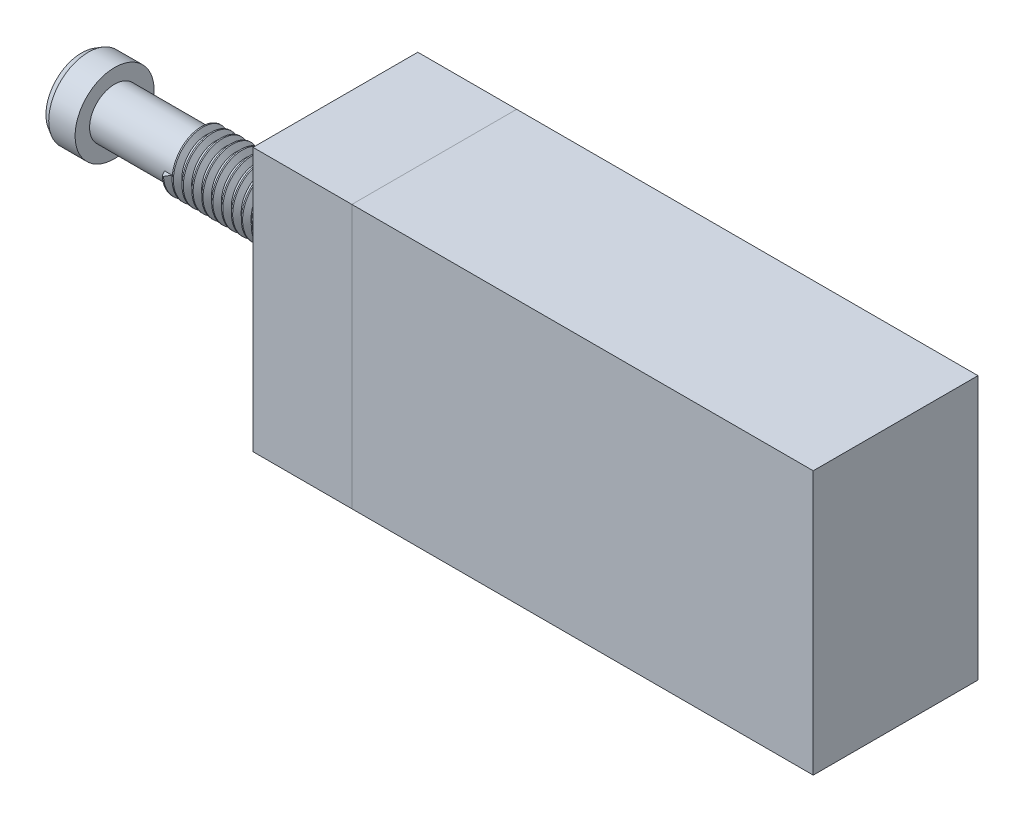
from build123d import *

# Parameters (mm, degrees)
EXTRUDE_1_DEPTH      = 25
SKETCH_2_W           = 3
SKETCH_2_H           = 40
EXTRUDE_2_DEPTH      = 70
SKETCH_4_W           = 5
SKETCH_4_H           = 30
EXTRUDE_3_DEPTH      = 22
SKETCH_11_W          = 3
SKETCH_11_H          = 29.924086267
CUT_EXTRUDE_3_DEPTH  = 7
SKETCH_13_W          = 3
SKETCH_13_H          = 30
EXTRUDE_5_DEPTH      = 25
SKETCH_6_W           = 3
SKETCH_6_H           = 5
SKETCH_6_H_2         = 30
SKETCH_6_W_2         = 19
SKETCH_6_W_3         = 22
SKETCH_6_H_3         = 40
EXTRUDE_6_DEPTH      = 15
SKETCH_14_W          = 19
SKETCH_14_H          = 34
SKETCH_14_R          = 4
CUT_EXTRUDE_4_DEPTH  = 7
SKETCH_14_2_R        = 4
CUT_EXTRUDE_5_DEPTH  = 9
SKETCH_8_R           = 4
CUT_EXTRUDE_6_DEPTH  = 10
THREAD_1_PITCH       = 1.5
SKETCH_14_3_R        = 4
EXTRUDE_7_DEPTH      = 55
SKETCH_20_R          = 6
EXTRUDE_8_DEPTH      = 5
CUT_EXTRUDE_START    = -5
SKETCH_20_10_R       = 4
SKETCH_20_10_R_2     = 3.8
CUT_EXTRUDE_10_DEPTH = 50
CHAMFER_3_SIZE       = 1
CHAMFER_3_SIZE2      = 0.577350269
CHAMFER_4_SIZE       = 1
CHAMFER_4_SIZE2      = 0.577350269
THREAD_2_PITCH       = 1.5


with BuildPart() as part:
    # Sketch 1 → 보스-돌출1 (new body)
    with BuildSketch(Plane.XY):
        Polygon((-70, 5), (-70, 0), (0, 0), (0, 40), (-70, 40), (-70, 35), (-5, 35), (-5, 5), align=None)
    extrude(amount=EXTRUDE_1_DEPTH)

    # 스케치2 → 보스-돌출2 (add)
    with BuildSketch(Plane(origin=(0, 0, 0), x_dir=(0, 0, -1), z_dir=(1, 0, 0))):
        with Locations((-23.5, 20)):
            Rectangle(SKETCH_2_W, SKETCH_2_H)
    extrude(amount=-EXTRUDE_2_DEPTH)

    # Sketch 4 → 보스-돌출3 (add)
    with BuildSketch(Plane(origin=(0, 0, 22), x_dir=(-1, 0, 0), z_dir=(0, 0, -1))):
        with Locations((57.5, 20)):
            Rectangle(SKETCH_4_W, SKETCH_4_H)
    extrude(amount=EXTRUDE_3_DEPTH)

    # 스케치11 → 컷-돌출3 (cut)
    with BuildSketch(Plane.ZY.offset(60)):
        with Locations((1.5, 20.037956867)):
            Rectangle(SKETCH_11_W, SKETCH_11_H)
    extrude(amount=-CUT_EXTRUDE_3_DEPTH, mode=Mode.SUBTRACT)

    # 스케치8 → 컷-돌출6 (cut)
    with BuildSketch(Plane.ZY.offset(60)):
        with Locations(Location((11, 20, 0), (0, 0, 180))):
            Circle(SKETCH_8_R)
    extrude(amount=-CUT_EXTRUDE_6_DEPTH, mode=Mode.SUBTRACT)

    # 나사산1: the profile of Sketch 1 2 profile screwed along a right-hand helix of 10 turns, 8 arcs to a turn; built about Z, then put on its axis
    thread_1_z = Axis((0, 0, 0), (0, 0, 1))
    thread_1_corners = [(3.9997, 0, -0.000173205), (4.811898812, 0, 0.468749998), (4.811898812, 0, 0.656249998), (3.9997, 0, 1.125173201)]
    with BuildLine(mode=Mode.PRIVATE) as thread_1_profile:
        Line(thread_1_corners[0], thread_1_corners[1])
        Line(thread_1_corners[1], thread_1_corners[2])
        Line(thread_1_corners[2], thread_1_corners[3])
        Line(thread_1_corners[3], thread_1_corners[0])
    thread_1_cap = Face(thread_1_profile.wire())
    thread_1_turn_angles = [0, 22.5, 45, 67.5, 90, 112.5, 135, 157.5, 180, 202.5, 225, 247.5, 270, 292.5, 315, 337.5, 360]
    thread_1_turn_weights = [1, 0.9238795325112867, 1, 0.9238795325112867, 1, 0.9238795325112867, 1, 0.9238795325112867, 1, 0.9238795325112867, 1, 0.9238795325112867, 1, 0.9238795325112867, 1, 0.9238795325112867, 1]
    thread_1_turn_rails = [Edge.make_bspline([Vector(p[0], p[1], 0).rotate(thread_1_z, thread_1_turn_angles[k]) / thread_1_turn_weights[k] + Vector(0, 0, p[2] + THREAD_1_PITCH * thread_1_turn_angles[k] / 360) for k in range(17)], [0, 0, 0, 1, 1, 2, 2, 3, 3, 4, 4, 5, 5, 6, 6, 7, 7, 8, 8, 8], 2, thread_1_turn_weights) for p in thread_1_corners]
    thread_1_turn_sides = [Face.make_surface_from_curves(thread_1_turn_rails[p[0]], thread_1_turn_rails[p[1]]) for p in [(0, 1), (1, 2), (2, 3), (3, 0)]]
    thread_1 = Plane(origin=(-70, 20, 11), x_dir=(0, 0, -1), z_dir=(1, 0, 0)) * Solid(Shell([*[p.moved(Location((0, 0, THREAD_1_PITCH * i))) for i in range(10) for p in thread_1_turn_sides], thread_1_cap, thread_1_cap.rotate(thread_1_z, 3600).moved(Location((0, 0, THREAD_1_PITCH * 3600 / 360)))]))
    add(thread_1, mode=Mode.SUBTRACT)


with BuildPart() as body_2:
    # 스케치13 → 보스-돌출5 (new body)
    with BuildSketch(Plane.ZY.offset(70)):
        with Locations((1.5, 20.075913733)):
            Rectangle(SKETCH_13_W, SKETCH_13_H)
    extrude(amount=-EXTRUDE_5_DEPTH)

    # 스케치6 → 보스-돌출6 (add)
    with BuildSketch(Plane.ZY.offset(70)):
        with Locations((1.5, 2.5)):
            Rectangle(SKETCH_6_W, SKETCH_6_H)
        with Locations((1.5, 20)):
            Rectangle(SKETCH_6_W, SKETCH_6_H_2)
        with Locations((1.5, 37.5)):
            Rectangle(SKETCH_6_W, SKETCH_6_H)
        with Locations((12.5, 20)):
            Rectangle(SKETCH_6_W_2, SKETCH_6_H_2)
        Polygon((25, 40), (3, 40), (3, 35), (22, 35), (22, 5), (3, 5), (3, 0), (25, 0), align=None)
        with Locations((14, 20)):
            Rectangle(SKETCH_6_W_3, SKETCH_6_H_3)
    extrude(amount=EXTRUDE_6_DEPTH)

    # 스케치14 → 컷-돌출4 (cut)
    with BuildSketch(Plane(origin=(-70, 0, 0), x_dir=(0, 0, -1), z_dir=(1, 0, 0))):
        with Locations((-12.5, 20)):
            Rectangle(SKETCH_14_W, SKETCH_14_H)
        with Locations((-11, 20)):
            Circle(SKETCH_14_R, mode=Mode.SUBTRACT)
    extrude(amount=-CUT_EXTRUDE_4_DEPTH, mode=Mode.SUBTRACT)

    # 스케치14<2> → 컷-돌출5 (cut)
    with BuildSketch(Plane(origin=(-70, 0, 0), x_dir=(0, 0, -1), z_dir=(1, 0, 0))):
        with Locations((-11, 20)):
            Circle(SKETCH_14_2_R)
    extrude(amount=-CUT_EXTRUDE_5_DEPTH, mode=Mode.SUBTRACT)


with BuildPart() as body_3:
    # 스케치14<3> → 보스-돌출7 (new body)
    with BuildSketch(Plane(origin=(-70, 0, 0), x_dir=(0, 0, -1), z_dir=(1, 0, 0))):
        with Locations((-11, 20)):
            Circle(SKETCH_14_3_R)
    extrude(amount=-EXTRUDE_7_DEPTH)

    # 스케치20 → 보스-돌출8 (add)
    with BuildSketch(Plane.ZY.offset(125)):
        with Locations((11, 20)):
            Circle(SKETCH_20_R)
    extrude(amount=-EXTRUDE_8_DEPTH)

    # 스케치20<10> → 컷-돌출10 (cut)
    with BuildSketch(Plane.ZY.offset(125).offset(CUT_EXTRUDE_START)):
        with Locations(Location((11, 20, 0), (0, 0, 180))):
            Circle(SKETCH_20_10_R)
        with Locations((11, 20)):
            Circle(SKETCH_20_10_R_2, mode=Mode.SUBTRACT)
    extrude(amount=-CUT_EXTRUDE_10_DEPTH, mode=Mode.SUBTRACT)

    # 모따기3
    chamfer_3_edges = [body_3.edges().sort_by_distance(p)[0] for p in [
        (-70, 20, 7.2),
    ]]
    chamfer_3_side = [body_3.faces().sort_by_distance(p)[0] for p in [
        (-70, 20, 11),
    ]]
    chamfer(chamfer_3_edges, length=CHAMFER_3_SIZE, length2=CHAMFER_3_SIZE2, reference=chamfer_3_side[0])

    # 모따기4
    chamfer_4_edges = [body_3.edges().sort_by_distance(p)[0] for p in [
        (-125, 20, 5),
    ]]
    chamfer_4_side = [body_3.faces().sort_by_distance(p)[0] for p in [
        (-122.5, 20, 5),
    ]]
    chamfer(chamfer_4_edges, length=CHAMFER_4_SIZE, length2=CHAMFER_4_SIZE2, reference=chamfer_4_side[0])

    # 나사산2: the profile of Sketch 4 2 profile screwed along a right-hand helix of 15 turns, 8 arcs to a turn; built about Z, then put on its axis
    thread_2_z = Axis((0, 0, 0), (0, 0, 1))
    thread_2_corners = [(3.7997, 0, -0.000173205), (4.611898813, 0, 0.468749998), (4.611898813, 0, 0.656249998), (3.7997, 0, 1.125173201)]
    with BuildLine(mode=Mode.PRIVATE) as thread_2_profile:
        Line(thread_2_corners[0], thread_2_corners[1])
        Line(thread_2_corners[1], thread_2_corners[2])
        Line(thread_2_corners[2], thread_2_corners[3])
        Line(thread_2_corners[3], thread_2_corners[0])
    thread_2_cap = Face(thread_2_profile.wire())
    thread_2_turn_angles = [0, 22.5, 45, 67.5, 90, 112.5, 135, 157.5, 180, 202.5, 225, 247.5, 270, 292.5, 315, 337.5, 360]
    thread_2_turn_weights = [1, 0.9238795325112867, 1, 0.9238795325112867, 1, 0.9238795325112867, 1, 0.9238795325112867, 1, 0.9238795325112867, 1, 0.9238795325112867, 1, 0.9238795325112867, 1, 0.9238795325112867, 1]
    thread_2_turn_rails = [Edge.make_bspline([Vector(p[0], p[1], 0).rotate(thread_2_z, thread_2_turn_angles[k]) / thread_2_turn_weights[k] + Vector(0, 0, p[2] + THREAD_2_PITCH * thread_2_turn_angles[k] / 360) for k in range(17)], [0, 0, 0, 1, 1, 2, 2, 3, 3, 4, 4, 5, 5, 6, 6, 7, 7, 8, 8, 8], 2, thread_2_turn_weights) for p in thread_2_corners]
    thread_2_turn_sides = [Face.make_surface_from_curves(thread_2_turn_rails[p[0]], thread_2_turn_rails[p[1]]) for p in [(0, 1), (1, 2), (2, 3), (3, 0)]]
    thread_2 = Plane(origin=(-85, 20, 11), x_dir=(0, 0, 1), z_dir=(-1, 0, 0)) * Solid(Shell([*[p.moved(Location((0, 0, THREAD_2_PITCH * i))) for i in range(15) for p in thread_2_turn_sides], thread_2_cap, thread_2_cap.rotate(thread_2_z, 5400).moved(Location((0, 0, THREAD_2_PITCH * 5400 / 360)))]))
    add(thread_2)


solid = Compound([part.part, body_2.part, body_3.part])
